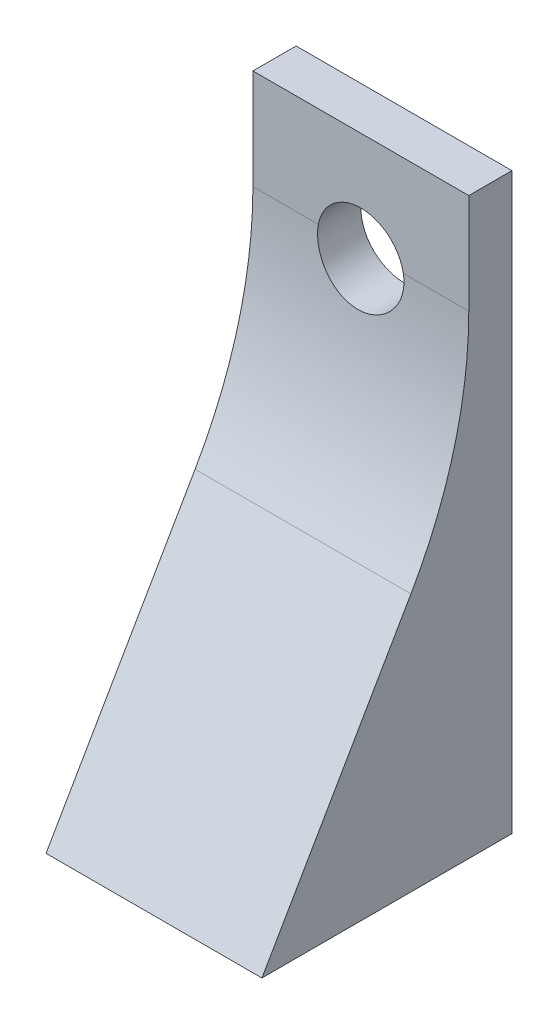
from build123d import *

# Parameters (mm, degrees)
SKETCH_1_W      = 5
SKETCH_1_H      = 13.3
SKETCH_1_R      = 1
EXTRUDE_1_DEPTH = 1
EXTRUDE_3_DEPTH = 2.5
FILLET_1_R      = 10


with BuildPart() as part:
    # 草图1 → 凸台-拉伸1 (new body)
    with BuildSketch(Plane.XY):
        Rectangle(SKETCH_1_W, SKETCH_1_H)
        with Locations((0, 4.15)):
            Circle(SKETCH_1_R, mode=Mode.SUBTRACT)
    extrude(amount=EXTRUDE_1_DEPTH)

    # 草图2 → 凸台-拉伸3 (add, symmetric)
    with BuildSketch(Plane(origin=(0, 0, 0), x_dir=(0, 0, -1), z_dir=(1, 0, 0))):
        Polygon((-1, 1.65), (-5.792007234, -6.65), (-1, -6.65), align=None)
    extrude(amount=EXTRUDE_3_DEPTH, both=True)

    # 圆角1
    # the kernel refuses this fillet: 10 mm, written as the material it adds along each edge
    with BuildSketch(Plane(origin=(2.5, 1.65, 1), x_dir=(0, 1, 0), z_dir=(-1, 0, 0))) as fillet_1_piece_1_section:
        with BuildLine():
            CenterArc((FILLET_1_R * 0.267949192431, -FILLET_1_R), FILLET_1_R, 90, 30)
            Line((-FILLET_1_R * 0.232050807569, -FILLET_1_R * 0.133974596216), (0, 0))
            Line((0, 0), (FILLET_1_R * 0.267949192431, 0))
        make_face()
    fillet_1_piece_1 = extrude(amount=5, mode=Mode.PRIVATE)
    fillet_1_piece_1 = fillet_1_piece_1 - Plane(origin=(0, 4.15, 1.267699118), x_dir=(1, 0, 0), z_dir=(0, 0, -1)) * Cylinder(1, 21, mode=Mode.PRIVATE)
    add(fillet_1_piece_1)


solid = part.part
